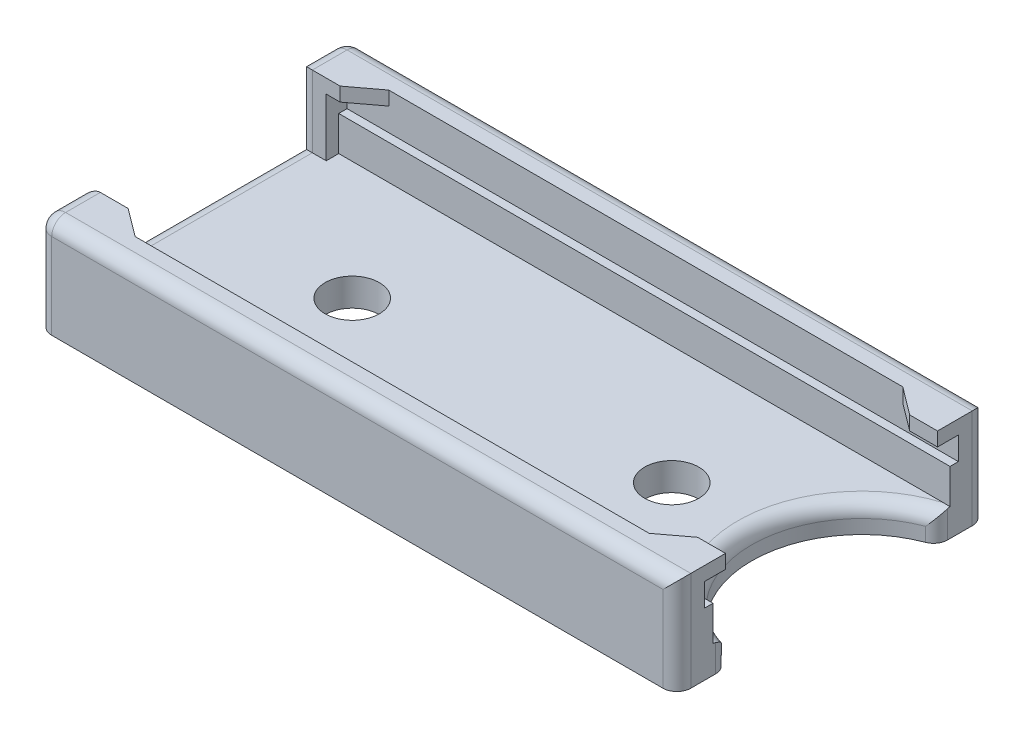
from build123d import *

# Parameters (mm, degrees)
BASE_W                   = 46
BASE_H                   = 22.26
RESSALTO_EXTRUS_O1_DEPTH = 2
RESSALTO_EXTRUS_O2_DEPTH = 5.16
RESSALTO_EXTRUS_O3_DEPTH = 2.5
RESSALTO_EXTRUS_O4_DEPTH = 1
FUROS_R                  = 1.9500000000000008
FUROS_R_2                = 1.9500000000000002
CORTE_EXTRUS_O1_DEPTH    = 2
CORTE_EXTRUS_O2_DEPTH    = 27.067268748374858
FILETE1_R                = 1


with BuildPart() as part:
    # Base → Ressalto-extrusão1 (new body)
    with BuildSketch(Plane(origin=(0, 0, 0), x_dir=(1, 0, 0), z_dir=(0, 1, 0))):
        Rectangle(BASE_W, BASE_H)
    extrude(amount=-RESSALTO_EXTRUS_O1_DEPTH)

    # Parede_Ext → Ressalto-extrusão2 (add)
    with BuildSketch(Plane(origin=(0, 0, 0), x_dir=(1, 0, 0), z_dir=(0, 1, 0))):
        Polygon((-22.999999999999996, -11.129999999999999), (23.000000000000004, -11.129999999999999), (23.000000000000004, -9.129999999999995), (-20.999999999999993, -9.129999999999999), (-20.999999999999993, -7.63000000000001), (-22.99999999999999, -7.63000000000001), align=None)
        Polygon((-22.999999999999996, 11.130000000000003), (-22.999999999999993, 7.630000000000005), (-20.999999999999996, 7.630000000000005), (-20.999999999999996, 9.130000000000004), (23.000000000000004, 9.13000000000001), (23.000000000000004, 11.130000000000003), align=None)
    extrude(amount=RESSALTO_EXTRUS_O2_DEPTH)

    # Parede_Int → Ressalto-extrusão3 (add)
    with BuildSketch(Plane(origin=(0, 0, 0), x_dir=(1, 0, 0), z_dir=(0, 1, 0))):
        Polygon((23.000000000000004, -9.12999999999999), (-20.999999999999993, -9.129999999999999), (-20.999999999999993, -8.53), (23.000000000000004, -8.52999999999999), align=None)
        Polygon((-20.999999999999996, 9.130000000000004), (23.000000000000004, 9.13000000000001), (23, 8.530000000000008), (-20.999999999999996, 8.530000000000005), align=None)
    extrude(amount=RESSALTO_EXTRUS_O3_DEPTH)

    # Esboço4 → Ressalto-extrusão4 (add)
    with BuildSketch(Plane(origin=(0, 5.16, 0), x_dir=(1, 0, 0), z_dir=(0, 1, 0))):
        Polygon((-20.999999999999996, 7.630000000000005), (-19.999999999999996, 7.630000000000005), (-17.999999999999996, 9.130000000000004), (-20.999999999999996, 9.130000000000004), align=None)
        Polygon((23.000000000000004, 9.13000000000001), (23.000000000000007, 7.630000000000009), (21.000000000000004, 7.630000000000009), (19.000000000000004, 9.13000000000001), align=None)
        Polygon((23.000000000000007, -9.130000000000003), (23.00000000000001, -7.630000000000004), (21.000000000000007, -7.630000000000004), (19.000000000000007, -9.130000000000006), align=None)
        Polygon((-20.999999999999993, -7.63000000000001), (-20.999999999999993, -9.130000000000008), (-17.999999999999993, -9.130000000000008), (-19.999999999999993, -7.63000000000001), align=None)
    extrude(amount=-RESSALTO_EXTRUS_O4_DEPTH)

    # Furos → Corte-extrusão1 (cut)
    with BuildSketch(Plane(origin=(0, 0, 0), x_dir=(1, 0, 0), z_dir=(0, 1, 0))):
        with Locations(Location((11.500000000000002, 0, 0), (0, 0, 270))):
            Circle(FUROS_R)
        with Locations(Location((-11.500000000000002, -7.17e-15, 0), (0, 0, 270))):
            Circle(FUROS_R_2)
    extrude(amount=-CORTE_EXTRUS_O1_DEPTH, mode=Mode.SUBTRACT)

    # Esboço5 → Corte-extrusão2 (cut, through all)
    with BuildSketch(Plane(origin=(0, 0, 0), x_dir=(1, 0, 0), z_dir=(0, 1, 0))):
        with BuildLine():
            ThreePointArc((23, 7.630000000000013), (17.249999999999993, 4.22e-15), (22.999999999999996, -7.630000000000007))
            Line((23.000000000000004, -7.630000000000007), (23, 7.630000000000013))
        make_face()
    extrude(amount=-CORTE_EXTRUS_O2_DEPTH, mode=Mode.SUBTRACT)

    # Filete1
    # the kernel refuses this fillet: 1 mm, written as the material it takes off along each edge
    with BuildSketch(Plane(origin=(-21.999999999999996, 4.16, -10.130000000000003), x_dir=(-1, 0, 0), z_dir=(0, 0, -1))) as filete1_piece_1_section:
        Polygon((0, 0), (FILETE1_R * 1.02, 0), (FILETE1_R * 1.02, FILETE1_R * 1.02), (0, FILETE1_R * 1.02), align=None)
    filete1_piece_1 = extrude(amount=FILETE1_R * 1.02, mode=Mode.PRIVATE)
    filete1_piece_1 = filete1_piece_1 - Plane(origin=(-21.999999999999996, 4.16, -10.130000000000003), x_dir=(0.7071067811865475, -0.7071067811865475, 0), z_dir=(0, 0, -1)) * Sphere(FILETE1_R, mode=Mode.PRIVATE)
    add(filete1_piece_1, mode=Mode.SUBTRACT)
    with BuildSketch(Plane(origin=(-21.999999999999996, 4.16, 10.129999999999999), x_dir=(0, 0, 1), z_dir=(-1, 0, 0))) as filete1_piece_2_section:
        Polygon((0, 0), (FILETE1_R * 1.02, 0), (FILETE1_R * 1.02, FILETE1_R * 1.02), (0, FILETE1_R * 1.02), align=None)
    filete1_piece_2 = extrude(amount=FILETE1_R * 1.02, mode=Mode.PRIVATE)
    filete1_piece_2 = filete1_piece_2 - Plane(origin=(-21.999999999999996, 4.16, 10.129999999999999), x_dir=(0, -0.7071067811865475, -0.7071067811865475), z_dir=(-1, 0, 0)) * Sphere(FILETE1_R, mode=Mode.PRIVATE)
    add(filete1_piece_2, mode=Mode.SUBTRACT)
    with BuildSketch(Plane(origin=(23, 1.7991616598128402, 7.630000000000007), x_dir=(4.94e-15, 0, 1), z_dir=(0, -1, 0))) as filete1_piece_3:
        with BuildLine():
            CenterArc((0.7196646639251312, 1), FILETE1_R, 200.8934853742789, 69.10651462572139)
            ThreePointArc((-0.21458036606277414, 0.6433682235934401), (-0.1004154392092536, 0.32397702119423805), (0, 0))
            Line((0, 0), (0.7196646639251361, 0))
        make_face()
    extrude(amount=5.59832331962568, mode=Mode.SUBTRACT)
    with BuildSketch(Plane(origin=(23, 1.799161659812838, -7.630000000000013), x_dir=(4.94e-15, 0, -1), z_dir=(0, -1, 0))) as filete1_piece_4:
        with BuildLine():
            CenterArc((0.7196646639251303, -1), FILETE1_R, 89.99999999999972, 69.10651462572139)
            ThreePointArc((-0.21458036606277503, -0.6433682235934401), (-0.10041543920925448, -0.3239770211942416), (0, 0))
            Line((0, 0), (0.7196646639251352, 0))
        make_face()
    extrude(amount=5.598323319625676, mode=Mode.SUBTRACT)
    with BuildSketch(Plane(origin=(25.187339130434786, 0, -2.89e-15), x_dir=(0.036112789028829015, 0, -0.9993477205000065), z_dir=(0.9993477205000065, 0, 0.036112789028829015))) as filete1_piece_5_section:
        with BuildLine():
            CenterArc((7.937339130434793 + FILETE1_R, -FILETE1_R), FILETE1_R, 90, 90)
            Line((7.937339130434793, -FILETE1_R), (7.937339130434793, 0))
            Line((7.937339130434793, 0), (7.937339130434793 + FILETE1_R, 0))
        make_face()
    filete1_piece_5 = revolve(axis=Axis((25.187339130434786, 0, -2.89e-15), (0, 1, 0)), revolution_arc=184.13912078928365, mode=Mode.PRIVATE)
    filete1_piece_5 = split(filete1_piece_5, bisect_by=Plane(origin=(25.187339130434786, 0, -8.530000000000008), z_dir=(8e-17, 0, 1)), keep=Keep.TOP, mode=Mode.PRIVATE)
    filete1_piece_5 = split(filete1_piece_5, bisect_by=Plane(origin=(25.187339130434786, 0, 8.52999999999999), z_dir=(-2e-16, 0, -1)), keep=Keep.TOP, mode=Mode.PRIVATE)
    add(filete1_piece_5, mode=Mode.SUBTRACT)
    with BuildSketch(Plane(origin=(-22.99999999999999, 0, 7.63000000000001), x_dir=(-7.11e-15, 0, 1), z_dir=(0, 1, 0))) as filete1_piece_6:
        with BuildLine():
            CenterArc((FILETE1_R, FILETE1_R), FILETE1_R, 180, 90.0000000000004)
            Line((-7.11e-15, FILETE1_R), (0, 0))
            Line((0, 0), (FILETE1_R, 0))
        make_face()
    extrude(amount=7.66, mode=Mode.SUBTRACT)
    with BuildSketch(Plane(origin=(-22.999999999999993, 0, -7.630000000000005), x_dir=(-3.55e-15, 0, -1), z_dir=(0, 1, 0))) as filete1_piece_7:
        with BuildLine():
            CenterArc((FILETE1_R, -FILETE1_R), FILETE1_R, 89.9999999999998, 90.0000000000002)
            Line((-2.66e-15, -FILETE1_R), (0, 0))
            Line((0, 0), (FILETE1_R, 0))
        make_face()
    extrude(amount=7.660000000000002, mode=Mode.SUBTRACT)
    with BuildSketch(Plane(origin=(-22.999999999999996, 0, 7.63000000000001), x_dir=(0, -1, 0), z_dir=(0, 0, -1))) as filete1_piece_8:
        with BuildLine():
            CenterArc((FILETE1_R, -FILETE1_R), FILETE1_R, 90, 90)
            Line((-1.1e-16, -FILETE1_R), (0, 0))
            Line((0, 0), (FILETE1_R, 0))
        make_face()
    extrude(amount=15.260000000000016, mode=Mode.SUBTRACT)
    with BuildSketch(Plane(origin=(-22.999999999999996, 5.16, -10.13), x_dir=(-3.55e-15, -1, 0), z_dir=(1.02e-15, 0, 1))) as filete1_piece_9:
        with BuildLine():
            CenterArc((FILETE1_R, FILETE1_R), FILETE1_R, 180, 90.00000000000023)
            Line((-3.55e-15, FILETE1_R), (0, 0))
            Line((0, 0), (FILETE1_R, 0))
        make_face()
    extrude(amount=4.999999999999996, mode=Mode.SUBTRACT)
    with BuildSketch(Plane(origin=(-22.999999999999996, -4.5, -11.130000000000003), x_dir=(1, 0, 0), z_dir=(0, 1, 0))) as filete1_piece_10:
        with BuildLine():
            CenterArc((FILETE1_R, -FILETE1_R), FILETE1_R, 90, 90)
            Line((0, -FILETE1_R), (0, 0))
            Line((0, 0), (FILETE1_R, 0))
        make_face()
    extrude(amount=8.66, mode=Mode.SUBTRACT)
    with BuildSketch(Plane(origin=(-22.999999999999996, -4.5, 11.129999999999999), x_dir=(0, 0, -1), z_dir=(0, 1, 0))) as filete1_piece_11:
        with BuildLine():
            CenterArc((FILETE1_R, -FILETE1_R), FILETE1_R, 90, 90)
            Line((0, -FILETE1_R), (0, 0))
            Line((0, 0), (FILETE1_R, 0))
        make_face()
    extrude(amount=8.66, mode=Mode.SUBTRACT)
    with BuildSketch(Plane(origin=(-22.999999999999986, 5.16, 5.13000000000001), x_dir=(-3.55e-15, -1, 0), z_dir=(-2.03e-15, 0, 1))) as filete1_piece_12:
        with BuildLine():
            CenterArc((FILETE1_R, FILETE1_R), FILETE1_R, 180, 90.00000000000023)
            Line((-3.55e-15, FILETE1_R), (0, 0))
            Line((0, 0), (FILETE1_R, 0))
        make_face()
    extrude(amount=4.999999999999989, mode=Mode.SUBTRACT)
    with BuildSketch(Plane(origin=(25.500000000000004, 5.16, -11.130000000000003), x_dir=(0, -1, 0), z_dir=(-1, 0, 0)), Plane(origin=(-21.999999999999996, 5.16, 11.129999999999999), x_dir=(0, -1, 0), z_dir=(1, 0, 0))) as filete1_piece_13:
        with BuildLine():
            CenterArc((FILETE1_R, FILETE1_R), FILETE1_R, 180, 90)
            Line((0, FILETE1_R), (0, 0))
            Line((0, 0), (FILETE1_R, 0))
        make_face()
    extrude(amount=47.5, mode=Mode.SUBTRACT)
    with BuildSketch(Plane(origin=(23.000000000000004, 7.66, -11.130000000000003), x_dir=(-1, 0, 0), z_dir=(0, -1, 0))) as filete1_piece_14:
        with BuildLine():
            CenterArc((FILETE1_R, -FILETE1_R), FILETE1_R, 90, 90)
            Line((0, -FILETE1_R), (0, 0))
            Line((0, 0), (FILETE1_R, 0))
        make_face()
    extrude(amount=12.16, mode=Mode.SUBTRACT)
    with BuildSketch(Plane(origin=(23.000000000000004, 7.66, 11.129999999999999), x_dir=(-1, 0, 0), z_dir=(0, -1, 0))) as filete1_piece_15:
        with BuildLine():
            CenterArc((FILETE1_R, FILETE1_R), FILETE1_R, 180, 90)
            Line((0, FILETE1_R), (0, 0))
            Line((0, 0), (FILETE1_R, 0))
        make_face()
    extrude(amount=12.16, mode=Mode.SUBTRACT)
    with BuildSketch(Plane(origin=(-22.999999999999996, 0, 10.13000000000001), x_dir=(0, -1, 0), z_dir=(0, 0, -1))) as filete1_piece_16a_section:
        with BuildLine():
            CenterArc((FILETE1_R, -FILETE1_R), FILETE1_R, 90, 90)
            Line((-1.1e-16, -FILETE1_R), (0, 0))
            Line((0, 0), (FILETE1_R, 0))
        make_face()
    filete1_piece_16a = extrude(amount=17.760000000000016, mode=Mode.PRIVATE)
    filete1_piece_16a = split(filete1_piece_16a, bisect_by=Plane(origin=(-22.999999999999996, 0, 7.63000000000001), z_dir=(0, 0, 1)), keep=Keep.TOP, mode=Mode.PRIVATE)
    with BuildSketch(Plane(origin=(-22.99999999999999, -2.5, 7.63000000000001), x_dir=(-7.11e-15, 0, 1), z_dir=(0, 1, 0))) as filete1_piece_16b_section:
        with BuildLine():
            CenterArc((FILETE1_R, FILETE1_R), FILETE1_R, 180, 90.0000000000004)
            Line((-7.11e-15, FILETE1_R), (0, 0))
            Line((0, 0), (FILETE1_R, 0))
        make_face()
    filete1_piece_16b = extrude(amount=7.66, mode=Mode.PRIVATE)
    filete1_piece_16b = split(filete1_piece_16b, bisect_by=Plane(origin=(-22.99999999999999, -2, 7.63000000000001), z_dir=(0, 1, 0)), keep=Keep.TOP, mode=Mode.PRIVATE)
    filete1_piece_16b = split(filete1_piece_16b, bisect_by=Plane(origin=(-22.99999999999999, 0, 7.63000000000001), z_dir=(0, -1, 0)), keep=Keep.TOP, mode=Mode.PRIVATE)
    filete1_piece_16 = filete1_piece_16a & filete1_piece_16b
    add(filete1_piece_16, mode=Mode.SUBTRACT)
    with BuildSketch(Plane(origin=(-22.999999999999993, -2.5000000000000018, -7.630000000000005), x_dir=(-3.55e-15, 0, -1), z_dir=(0, 1, 0))) as filete1_piece_17a_section:
        with BuildLine():
            CenterArc((FILETE1_R, -FILETE1_R), FILETE1_R, 89.9999999999998, 90.0000000000002)
            Line((-2.66e-15, -FILETE1_R), (0, 0))
            Line((0, 0), (FILETE1_R, 0))
        make_face()
    filete1_piece_17a = extrude(amount=7.660000000000002, mode=Mode.PRIVATE)
    filete1_piece_17a = split(filete1_piece_17a, bisect_by=Plane(origin=(-22.999999999999993, -2, -7.630000000000005), z_dir=(0, 1, 0)), keep=Keep.TOP, mode=Mode.PRIVATE)
    filete1_piece_17a = split(filete1_piece_17a, bisect_by=Plane(origin=(-22.999999999999993, 0, -7.630000000000005), z_dir=(0, -1, 0)), keep=Keep.TOP, mode=Mode.PRIVATE)
    with BuildSketch(Plane(origin=(-22.999999999999996, 0, 7.63000000000001), x_dir=(0, -1, 0), z_dir=(0, 0, -1))) as filete1_piece_17b_section:
        with BuildLine():
            CenterArc((FILETE1_R, -FILETE1_R), FILETE1_R, 90, 90)
            Line((-1.1e-16, -FILETE1_R), (0, 0))
            Line((0, 0), (FILETE1_R, 0))
        make_face()
    filete1_piece_17b = extrude(amount=17.760000000000016, mode=Mode.PRIVATE)
    filete1_piece_17b = split(filete1_piece_17b, bisect_by=Plane(origin=(-22.999999999999996, 0, -7.630000000000006), z_dir=(0, 0, -1)), keep=Keep.TOP, mode=Mode.PRIVATE)
    filete1_piece_17 = filete1_piece_17a & filete1_piece_17b
    add(filete1_piece_17, mode=Mode.SUBTRACT)


solid = part.part
